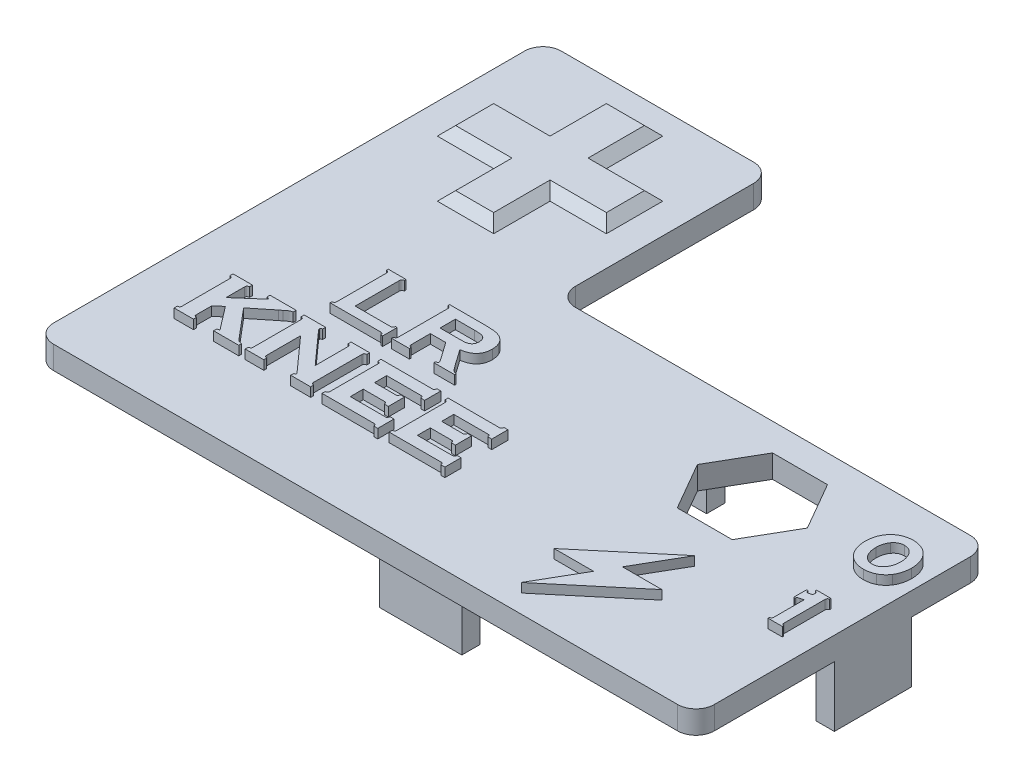
from build123d import *

# Parameters (mm, degrees)
BOSS_EXTRUDE1_DEPTH = 2.5
FILLET1_R           = 2
SKETCH2_W           = 2
SKETCH2_H           = 8.4
SKETCH2_W_2         = 9
SKETCH2_H_2         = 2
BOSS_EXTRUDE2_DEPTH = 6.6
BOSS_EXTRUDE3_DEPTH = 1
CUT_EXTRUDE1_DEPTH  = 2.5
CHAMFER1_SIZE       = 1


with BuildPart() as part:
    # Sketch1 → Boss-Extrude1 (new body)
    with BuildSketch(Plane(origin=(0, 0, 0), x_dir=(1, 0, 0), z_dir=(0, 1, 0))):
        Polygon((-36.05, 15.975), (-36.05, 39.425), (-11.05, 39.425), (-11.05, 15.975), (36.05, 15.975), (36.05, -15.975), (-36.05, -15.975), align=None)
    extrude(amount=BOSS_EXTRUDE1_DEPTH)

    # Fillet1
    fillet1_edges = [part.edges().sort_by_distance(p)[0] for p in [
        (36.05, 1.25, 15.975),
        (-36.05, 1.25, 15.975),
        (-36.05, 1.25, -39.425),
        (-11.05, 1.25, -39.425),
        (-11.05, 1.25, -15.975),
        (36.05, 1.25, -15.975),
    ]]
    fillet(fillet1_edges, radius=FILLET1_R)

    # Sketch2 → Boss-Extrude2 (add)
    with BuildSketch(Plane.XZ):
        with Locations((35.05, -3.325)):
            Rectangle(SKETCH2_W, SKETCH2_H)
        with Locations((4, -13.725)):
            Rectangle(SKETCH2_W_2, SKETCH2_H_2)
        with Locations((4, 12.975)):
            Rectangle(SKETCH2_W_2, SKETCH2_H_2)
    extrude(amount=BOSS_EXTRUDE2_DEPTH)

    # Sketch3 → Boss-Extrude3 (add)
    # profile 1 of 10: a face of its own
    with BuildSketch(Plane(origin=(0, 2.5, 0), x_dir=(1, 0, 0), z_dir=(0, 1, 0))):
        Polygon((21.914101615, -1.975), (19.027350269, -6.975), (23.328173533, -6.975), (14.985898385, -13.975), (17.872649731, -8.975), (13.571826467, -8.975), align=None)
    # profile 2 of 10: a face of its own
    with BuildSketch(Plane(origin=(0, 2.5, 0), x_dir=(1, 0, 0), z_dir=(0, 1, 0))):
        Polygon((-26.625, 36.925), (-20.475, 36.925), (-20.475, 30.775), (-14.325, 30.775), (-14.325, 24.625), (-20.475, 24.625), (-20.475, 18.475), (-26.625, 18.475), (-26.625, 24.625), (-32.775, 24.625), (-32.775, 30.775), (-26.625, 30.775), align=None)
    # profile 3 of 10: a face of its own
    with BuildSketch(Plane(origin=(0, 2.5, 0), x_dir=(1, 0, 0), z_dir=(0, 1, 0))):
        with BuildLine():
            Line((-27.247591146, -4.027376302), (-28.044097222, -4.731553819))
            Line((-28.044097222, -4.731553819), (-28.044097222, -6.378309462))
            add(Edge.make_bspline(
                [(-28.044097222, -6.378309462), (-28.043614142, -6.399472319), (-28.042739336, -6.437795987), (-28.035657403, -6.489945623), (-28.02621669, -6.531568086), (-28.008147517, -6.565285209), (-27.974962409, -6.59109629), (-27.926455941, -6.614285804), (-27.859074511, -6.638583322), (-27.80806186, -6.654600019), (-27.779513889, -6.663563368)],
                knots=[0, 0, 0, 0, 1.148820936, 2.080391588, 2.85507263, 3.458551883, 4.113480583, 5.09547749, 6.374555674, 8, 8, 8, 8], degree=3))
            Line((-27.779513889, -6.663563368), (-27.779513889, -6.975))
            Line((-27.779513889, -6.975), (-29.896180556, -6.975))
            Line((-29.896180556, -6.975), (-29.896180556, -6.645648872))
            add(Edge.make_bspline(
                [(-29.896180556, -6.645648872), (-29.868125509, -6.636151539), (-29.817620866, -6.619054457), (-29.750632152, -6.594290002), (-29.702846169, -6.568424236), (-29.659464272, -6.534244531), (-29.634968184, -6.466247275), (-29.632831214, -6.41050045), (-29.631597222, -6.378309462)],
                knots=[0, 0, 0, 0, 1.270903566, 2.287878308, 3.055159144, 3.600028367, 4.614137041, 6, 6, 6, 6], degree=3))
            Line((-29.631597222, -6.378309462), (-29.631597222, -1.127983941))
            add(Edge.make_bspline(
                [(-29.631597222, -1.127983941), (-29.632760861, -1.09708089), (-29.634782292, -1.043397214), (-29.66024702, -0.97844533), (-29.702812577, -0.944749705), (-29.750645988, -0.918897567), (-29.817615885, -0.894127705), (-29.868123731, -0.877031544), (-29.896180556, -0.867534722)],
                knots=[0, 0, 0, 0, 1.348336138, 2.342281394, 2.895882114, 3.675458579, 4.708730281, 6, 6, 6, 6], degree=3))
            Line((-29.896180556, -0.867534722), (-29.896180556, -0.536805556))
            Line((-29.896180556, -0.536805556), (-27.779513889, -0.536805556))
            Line((-27.779513889, -0.536805556), (-27.779513889, -0.850998264))
            add(Edge.make_bspline(
                [(-27.779513889, -0.850998264), (-27.808604169, -0.859263131), (-27.86035741, -0.873966793), (-27.92739581, -0.899411349), (-27.976517897, -0.92063671), (-28.009276456, -0.946020118), (-28.025676001, -0.978778043), (-28.03589813, -1.017604085), (-28.042562776, -1.066223073), (-28.043557084, -1.101778809), (-28.044097222, -1.12109375)],
                knots=[0, 0, 0, 0, 1.689553727, 3.005810864, 4.004869542, 4.678835048, 5.264901578, 6.012599175, 6.920384306, 8, 8, 8, 8], degree=3))
            Line((-28.044097222, -1.12109375), (-28.044097222, -3.15921224))
            Line((-28.044097222, -3.15921224), (-25.746907552, -1.147276476))
            add(Edge.make_bspline(
                [(-25.746907552, -1.147276476), (-25.72505987, -1.129143656), (-25.686439291, -1.097089912), (-25.639092829, -1.052208786), (-25.608302482, -1.016007235), (-25.600873058, -0.992230514), (-25.598079427, -0.983289931)],
                knots=[0, 0, 0, 0, 1.515017203, 2.678125759, 3.502945504, 4, 4, 4, 4], degree=3))
            add(Edge.make_bspline(
                [(-25.598079427, -0.983289931), (-25.6027921, -0.972871707), (-25.615528981, -0.944714503), (-25.67549815, -0.922434641), (-25.757063022, -0.894133596), (-25.825856322, -0.881620882), (-25.865418837, -0.874424913)],
                knots=[0, 0, 0, 0, 0.446973481, 1.208029717, 2.394358675, 4, 4, 4, 4], degree=3))
            Line((-25.865418837, -0.874424913), (-25.865418837, -0.536805556))
            Line((-25.865418837, -0.536805556), (-23.017013889, -0.536805556))
            Line((-23.017013889, -0.536805556), (-23.017013889, -0.859266493))
            add(Edge.make_bspline(
                [(-23.017013889, -0.859266493), (-23.05420703, -0.867039679), (-23.119525289, -0.880690878), (-23.205630499, -0.899085661), (-23.264473909, -0.916834955), (-23.302334751, -0.929405829), (-23.324552038, -0.94737057), (-23.350549511, -0.965117026), (-23.385491064, -0.992852381), (-23.43105823, -1.028538429), (-23.486145288, -1.072692799), (-23.551023452, -1.125487776), (-23.62675191, -1.185630628), (-23.680346475, -1.228994311), (-23.708789062, -1.252007378)],
                knots=[0, 0, 0, 0, 1.684495241, 2.95829537, 3.892088238, 4.42126145, 4.698089674, 5.149995523, 5.817617521, 6.672678047, 7.715250913, 8.945376179, 10.378913871, 12, 12, 12, 12], degree=3))
            Line((-23.708789062, -1.252007378), (-23.994042969, -1.46422526))
            Line((-23.994042969, -1.46422526), (-26.112087674, -3.172992622))
            Line((-26.112087674, -3.172992622), (-23.739105903, -5.986946615))
            add(Edge.make_bspline(
                [(-23.739105903, -5.986946615), (-23.710640531, -6.021868095), (-23.656609312, -6.088153903), (-23.579507577, -6.182305046), (-23.509269617, -6.265043392), (-23.445716352, -6.337048307), (-23.388972388, -6.398402958), (-23.341940336, -6.451477179), (-23.299707346, -6.491542629), (-23.252851428, -6.53433952), (-23.185902519, -6.575932546), (-23.089850939, -6.615313875), (-22.972936565, -6.649291216), (-22.886745928, -6.664872196), (-22.840625, -6.673209635)],
                knots=[0, 0, 0, 0, 1.3856826, 2.630217524, 3.742735644, 4.723579208, 5.583639575, 6.31351798, 6.903006854, 7.373487758, 8.263094004, 9.3075047, 10.559235838, 12, 12, 12, 12], degree=3))
            Line((-22.840625, -6.673209635), (-22.840625, -6.975))
            Line((-22.840625, -6.975), (-25.580164931, -6.975))
            Line((-25.580164931, -6.975), (-25.580164931, -6.638758681))
            add(Edge.make_bspline(
                [(-25.580164931, -6.638758681), (-25.543953919, -6.631181887), (-25.481134588, -6.618037568), (-25.405113126, -6.593213057), (-25.350570335, -6.572288109), (-25.337935176, -6.547034268), (-25.333496094, -6.538161892)],
                knots=[0, 0, 0, 0, 1.609728793, 2.792578347, 3.575799217, 4, 4, 4, 4], degree=3))
            add(Edge.make_bspline(
                [(-25.333496094, -6.538161892), (-25.337343345, -6.528360921), (-25.349550932, -6.49726178), (-25.392594167, -6.442765021), (-25.456187732, -6.358573837), (-25.50868088, -6.294077528), (-25.538823785, -6.257042101)],
                knots=[0, 0, 0, 0, 0.360711672, 1.144562472, 2.360334903, 4, 4, 4, 4], degree=3))
            Line((-25.538823785, -6.257042101), (-27.247591146, -4.027376302))
        make_face()
    # profile 4 of 10: a face of its own
    with BuildSketch(Plane(origin=(0, 2.5, 0), x_dir=(1, 0, 0), z_dir=(0, 1, 0))):
        with BuildLine():
            Line((-20.371180556, -2.697569444), (-20.371180556, -6.378309462))
            add(Edge.make_bspline(
                [(-20.371180556, -6.378309462), (-20.370486031, -6.399897216), (-20.369242065, -6.438563153), (-20.364587286, -6.491497032), (-20.354507946, -6.532130236), (-20.338116323, -6.565843949), (-20.304345381, -6.589008268), (-20.25705099, -6.613648804), (-20.188483243, -6.638793202), (-20.136050097, -6.655536385), (-20.106597222, -6.664941406)],
                knots=[0, 0, 0, 0, 1.168297272, 2.092543193, 2.863626271, 3.430493718, 4.06657787, 5.021996077, 6.327188346, 8, 8, 8, 8], degree=3))
            Line((-20.106597222, -6.664941406), (-20.106597222, -6.975))
            Line((-20.106597222, -6.975), (-22.135069444, -6.975))
            Line((-22.135069444, -6.975), (-22.135069444, -6.645648872))
            add(Edge.make_bspline(
                [(-22.135069444, -6.645648872), (-22.107014398, -6.636151539), (-22.056509755, -6.619054457), (-21.989521041, -6.594290002), (-21.941735058, -6.568424236), (-21.89835316, -6.534244531), (-21.873857072, -6.466247275), (-21.871720103, -6.41050045), (-21.870486111, -6.378309462)],
                knots=[0, 0, 0, 0, 1.270903566, 2.287878308, 3.055159144, 3.600028367, 4.614137041, 6, 6, 6, 6], degree=3))
            Line((-21.870486111, -6.378309462), (-21.870486111, -1.127983941))
            add(Edge.make_bspline(
                [(-21.870486111, -1.127983941), (-21.87164975, -1.09708089), (-21.873671181, -1.043397214), (-21.899135909, -0.97844533), (-21.941701466, -0.944749705), (-21.989534877, -0.918897567), (-22.056504774, -0.894127705), (-22.10701262, -0.877031544), (-22.135069444, -0.867534722)],
                knots=[0, 0, 0, 0, 1.348336138, 2.342281394, 2.895882114, 3.675458579, 4.708730281, 6, 6, 6, 6], degree=3))
            Line((-22.135069444, -0.867534722), (-22.135069444, -0.536805556))
            Line((-22.135069444, -0.536805556), (-19.800672743, -0.536805556))
            Line((-19.800672743, -0.536805556), (-19.800672743, -0.852376302))
            add(Edge.make_bspline(
                [(-19.800672743, -0.852376302), (-19.829012696, -0.861127625), (-19.879583335, -0.876743742), (-19.944116626, -0.90956379), (-19.985225933, -0.956210264), (-19.99090704, -0.992352602), (-19.99359809, -1.009472656)],
                knots=[0, 0, 0, 0, 1.333897094, 2.380244923, 3.232747595, 4, 4, 4, 4], degree=3))
            add(Edge.make_bspline(
                [(-19.99359809, -1.009472656), (-19.990089309, -1.042843704), (-19.982967936, -1.11057311), (-19.939736703, -1.163265439), (-19.91780599, -1.18999566)],
                knots=[0, 0, 0, 0, 0.985422698, 2, 2, 2, 2], degree=3))
            Line((-19.91780599, -1.18999566), (-16.755208333, -4.719151476))
            Line((-16.755208333, -4.719151476), (-16.755208333, -1.127983941))
            add(Edge.make_bspline(
                [(-16.755208333, -1.127983941), (-16.756371972, -1.09708089), (-16.758393403, -1.043397214), (-16.783858131, -0.97844533), (-16.826423688, -0.944749705), (-16.874257099, -0.918897567), (-16.941226996, -0.894127705), (-16.991734842, -0.877031544), (-17.019791667, -0.867534722)],
                knots=[0, 0, 0, 0, 1.348336138, 2.342281394, 2.895882114, 3.675458579, 4.708730281, 6, 6, 6, 6], degree=3))
            Line((-17.019791667, -0.867534722), (-17.019791667, -0.536805556))
            Line((-17.019791667, -0.536805556), (-14.991319444, -0.536805556))
            Line((-14.991319444, -0.536805556), (-14.991319444, -0.848242187))
            add(Edge.make_bspline(
                [(-14.991319444, -0.848242187), (-15.020339683, -0.857626663), (-15.072326352, -0.874437952), (-15.1404688, -0.900165223), (-15.189402175, -0.923510568), (-15.222504384, -0.948727557), (-15.238775464, -0.981558828), (-15.24960282, -1.020687503), (-15.253796275, -1.070960242), (-15.255156418, -1.107779735), (-15.255902778, -1.127983941)],
                knots=[0, 0, 0, 0, 1.677063113, 3.004280154, 3.998210204, 4.661097541, 5.237530725, 5.972938197, 6.887676847, 8, 8, 8, 8], degree=3))
            Line((-15.255902778, -1.127983941), (-15.255902778, -6.378309462))
            add(Edge.make_bspline(
                [(-15.255902778, -6.378309462), (-15.255208253, -6.399897216), (-15.253964287, -6.438563153), (-15.249309509, -6.491497032), (-15.239230169, -6.532130236), (-15.222838545, -6.565843949), (-15.189067603, -6.589008268), (-15.141773212, -6.613648804), (-15.073205465, -6.638793202), (-15.02077232, -6.655536385), (-14.991319444, -6.664941406)],
                knots=[0, 0, 0, 0, 1.168297272, 2.092543193, 2.863626271, 3.430493718, 4.06657787, 5.021996077, 6.327188346, 8, 8, 8, 8], degree=3))
            Line((-14.991319444, -6.664941406), (-14.991319444, -6.975))
            Line((-14.991319444, -6.975), (-17.172753906, -6.975))
            Line((-17.172753906, -6.975), (-17.172753906, -6.640136719))
            add(Edge.make_bspline(
                [(-17.172753906, -6.640136719), (-17.144688608, -6.633446707), (-17.095490609, -6.621719228), (-17.036525288, -6.592542598), (-16.992329434, -6.559640341), (-16.987541059, -6.528873277), (-16.985340712, -6.514735243)],
                knots=[0, 0, 0, 0, 1.427158009, 2.501784109, 3.311542117, 4, 4, 4, 4], degree=3))
            add(Edge.make_bspline(
                [(-16.985340712, -6.514735243), (-16.98895039, -6.502543418), (-16.998709509, -6.469581625), (-17.039839127, -6.416367421), (-17.101478263, -6.344175674), (-17.152219059, -6.290351523), (-17.181022135, -6.259798177)],
                knots=[0, 0, 0, 0, 0.467922828, 1.265075161, 2.447516532, 4, 4, 4, 4], degree=3))
            Line((-17.181022135, -6.259798177), (-20.371180556, -2.697569444))
        make_face()
    # profile 5 of 10: a face of its own
    with BuildSketch(Plane(origin=(0, 2.5, 0), x_dir=(1, 0, 0), z_dir=(0, 1, 0))):
        with BuildLine():
            Line((-11.904513889, -4.329166667), (-11.904513889, -5.740277778))
            Line((-11.904513889, -5.740277778), (-8.08734809, -5.740277778))
            add(Edge.make_bspline(
                [(-8.08734809, -5.740277778), (-8.056397323, -5.739196439), (-8.002019061, -5.737296604), (-7.936927508, -5.710572029), (-7.90265729, -5.667750897), (-7.877156292, -5.619542044), (-7.850290079, -5.553870821), (-7.834297431, -5.50339503), (-7.825520833, -5.475694444)],
                knots=[0, 0, 0, 0, 1.34636125, 2.365459444, 2.918249314, 3.696683944, 4.73596426, 6, 6, 6, 6], degree=3))
            Line((-7.825520833, -5.475694444), (-7.406597222, -5.475694444))
            Line((-7.406597222, -5.475694444), (-7.406597222, -7.239583333))
            Line((-7.406597222, -7.239583333), (-7.825520833, -7.239583333))
            add(Edge.make_bspline(
                [(-7.825520833, -7.239583333), (-7.835001074, -7.211528728), (-7.851930948, -7.161428635), (-7.876789708, -7.094617869), (-7.904172014, -7.047847345), (-7.937939248, -7.005029981), (-8.001016174, -6.978204932), (-8.053625296, -6.976153677), (-8.083213976, -6.975)],
                knots=[0, 0, 0, 0, 1.304247938, 2.329134225, 3.126603422, 3.68576824, 4.698418437, 6, 6, 6, 6], degree=3))
            Line((-8.083213976, -6.975), (-13.756597222, -6.975))
            Line((-13.756597222, -6.975), (-13.756597222, -6.645648872))
            add(Edge.make_bspline(
                [(-13.756597222, -6.645648872), (-13.728542176, -6.636151539), (-13.678037533, -6.619054457), (-13.611048819, -6.594290002), (-13.563262836, -6.568424236), (-13.519880938, -6.534244531), (-13.49538485, -6.466247275), (-13.493247881, -6.41050045), (-13.492013889, -6.378309462)],
                knots=[0, 0, 0, 0, 1.270903566, 2.287878308, 3.055159144, 3.600028367, 4.614137041, 6, 6, 6, 6], degree=3))
            Line((-13.492013889, -6.378309462), (-13.492013889, -1.133496094))
            add(Edge.make_bspline(
                [(-13.492013889, -1.133496094), (-13.493129536, -1.101255409), (-13.495047109, -1.045840197), (-13.520270062, -0.978690716), (-13.563247044, -0.944754866), (-13.611055323, -0.918895441), (-13.678035191, -0.894128471), (-13.72854134, -0.877031817), (-13.756597222, -0.867534722)],
                knots=[0, 0, 0, 0, 1.390022291, 2.38916702, 2.935671537, 3.705255179, 4.725282125, 6, 6, 6, 6], degree=3))
            Line((-13.756597222, -0.867534722), (-13.756597222, -0.536805556))
            Line((-13.756597222, -0.536805556), (-8.172786458, -0.536805556))
            add(Edge.make_bspline(
                [(-8.172786458, -0.536805556), (-8.142733987, -0.53571096), (-8.089655793, -0.533777704), (-8.026124978, -0.50678001), (-7.992386225, -0.46395028), (-7.964640924, -0.416868232), (-7.940723815, -0.349691075), (-7.923319713, -0.299770719), (-7.913715278, -0.272222222)],
                knots=[0, 0, 0, 0, 1.317339458, 2.326663858, 2.883992238, 3.678842347, 4.719071565, 6, 6, 6, 6], degree=3))
            Line((-7.913715278, -0.272222222), (-7.494791667, -0.272222222))
            Line((-7.494791667, -0.272222222), (-7.494791667, -2.036111111))
            Line((-7.494791667, -2.036111111), (-7.913715278, -2.036111111))
            add(Edge.make_bspline(
                [(-7.913715278, -2.036111111), (-7.92239102, -2.00835834), (-7.938073465, -1.958191877), (-7.965816655, -1.893457716), (-7.990605526, -1.844806679), (-8.027257116, -1.802911028), (-8.091564121, -1.774295539), (-8.146309251, -1.772520378), (-8.176920573, -1.771527778)],
                knots=[0, 0, 0, 0, 1.263696698, 2.284283375, 3.062509213, 3.628357544, 4.673870881, 6, 6, 6, 6], degree=3))
            Line((-8.176920573, -1.771527778), (-11.904513889, -1.771527778))
            Line((-11.904513889, -1.771527778), (-11.904513889, -3.094444444))
            Line((-11.904513889, -3.094444444), (-9.583897569, -3.094444444))
            add(Edge.make_bspline(
                [(-9.583897569, -3.094444444), (-9.552984438, -3.093286079), (-9.499283249, -3.091273808), (-9.43442255, -3.065761382), (-9.400262411, -3.022985336), (-9.37562489, -2.974541889), (-9.34936366, -2.908395749), (-9.333622038, -2.858012697), (-9.324826389, -2.829861111)],
                knots=[0, 0, 0, 0, 1.350007337, 2.345184541, 2.899471423, 3.697568048, 4.713513627, 6, 6, 6, 6], degree=3))
            Line((-9.324826389, -2.829861111), (-8.905902778, -2.829861111))
            Line((-8.905902778, -2.829861111), (-8.905902778, -4.59375))
            Line((-8.905902778, -4.59375), (-9.324826389, -4.59375))
            add(Edge.make_bspline(
                [(-9.324826389, -4.59375), (-9.334395473, -4.566642156), (-9.351710657, -4.517590719), (-9.376075187, -4.451549956), (-9.403451363, -4.404719593), (-9.437477396, -4.361965651), (-9.500379724, -4.333328245), (-9.553764905, -4.330668136), (-9.583897569, -4.329166667)],
                knots=[0, 0, 0, 0, 1.26750182, 2.293534889, 3.091896403, 3.651686891, 4.674521096, 6, 6, 6, 6], degree=3))
            Line((-9.583897569, -4.329166667), (-11.904513889, -4.329166667))
        make_face()
    # profile 6 of 10: a face of its own
    with BuildSketch(Plane(origin=(0, 2.5, 0), x_dir=(1, 0, 0), z_dir=(0, 1, 0))):
        with BuildLine():
            Line((-4.584375, -4.329166667), (-4.584375, -5.740277778))
            Line((-4.584375, -5.740277778), (-0.767209201, -5.740277778))
            add(Edge.make_bspline(
                [(-0.767209201, -5.740277778), (-0.736258434, -5.739196439), (-0.681880172, -5.737296604), (-0.616788619, -5.710572029), (-0.582518401, -5.667750897), (-0.557017403, -5.619542044), (-0.53015119, -5.553870821), (-0.514158542, -5.50339503), (-0.505381944, -5.475694444)],
                knots=[0, 0, 0, 0, 1.34636125, 2.365459444, 2.918249314, 3.696683944, 4.73596426, 6, 6, 6, 6], degree=3))
            Line((-0.505381944, -5.475694444), (-0.086458333, -5.475694444))
            Line((-0.086458333, -5.475694444), (-0.086458333, -7.239583333))
            Line((-0.086458333, -7.239583333), (-0.505381944, -7.239583333))
            add(Edge.make_bspline(
                [(-0.505381944, -7.239583333), (-0.514862185, -7.211528728), (-0.531792059, -7.161428635), (-0.556650819, -7.094617869), (-0.584033125, -7.047847345), (-0.617800359, -7.005029981), (-0.680877285, -6.978204932), (-0.733486407, -6.976153677), (-0.763075087, -6.975)],
                knots=[0, 0, 0, 0, 1.304247938, 2.329134225, 3.126603422, 3.68576824, 4.698418437, 6, 6, 6, 6], degree=3))
            Line((-0.763075087, -6.975), (-6.436458333, -6.975))
            Line((-6.436458333, -6.975), (-6.436458333, -6.645648872))
            add(Edge.make_bspline(
                [(-6.436458333, -6.645648872), (-6.408403287, -6.636151539), (-6.357898644, -6.619054457), (-6.29090993, -6.594290002), (-6.243123947, -6.568424236), (-6.199742049, -6.534244531), (-6.175245961, -6.466247275), (-6.173108992, -6.41050045), (-6.171875, -6.378309462)],
                knots=[0, 0, 0, 0, 1.270903566, 2.287878308, 3.055159144, 3.600028367, 4.614137041, 6, 6, 6, 6], degree=3))
            Line((-6.171875, -6.378309462), (-6.171875, -1.133496094))
            add(Edge.make_bspline(
                [(-6.171875, -1.133496094), (-6.172990647, -1.101255409), (-6.17490822, -1.045840197), (-6.200131173, -0.978690716), (-6.243108155, -0.944754866), (-6.290916434, -0.918895441), (-6.357896302, -0.894128471), (-6.408402451, -0.877031817), (-6.436458333, -0.867534722)],
                knots=[0, 0, 0, 0, 1.390022291, 2.38916702, 2.935671537, 3.705255179, 4.725282125, 6, 6, 6, 6], degree=3))
            Line((-6.436458333, -0.867534722), (-6.436458333, -0.536805556))
            Line((-6.436458333, -0.536805556), (-0.852647569, -0.536805556))
            add(Edge.make_bspline(
                [(-0.852647569, -0.536805556), (-0.822595098, -0.53571096), (-0.769516904, -0.533777704), (-0.705986089, -0.50678001), (-0.672247336, -0.46395028), (-0.644502035, -0.416868232), (-0.620584926, -0.349691075), (-0.603180824, -0.299770719), (-0.593576389, -0.272222222)],
                knots=[0, 0, 0, 0, 1.317339458, 2.326663858, 2.883992238, 3.678842347, 4.719071565, 6, 6, 6, 6], degree=3))
            Line((-0.593576389, -0.272222222), (-0.174652778, -0.272222222))
            Line((-0.174652778, -0.272222222), (-0.174652778, -2.036111111))
            Line((-0.174652778, -2.036111111), (-0.593576389, -2.036111111))
            add(Edge.make_bspline(
                [(-0.593576389, -2.036111111), (-0.602252131, -2.00835834), (-0.617934576, -1.958191877), (-0.645677766, -1.893457716), (-0.670466637, -1.844806679), (-0.707118227, -1.802911028), (-0.771425232, -1.774295539), (-0.826170362, -1.772520378), (-0.856781684, -1.771527778)],
                knots=[0, 0, 0, 0, 1.263696698, 2.284283375, 3.062509213, 3.628357544, 4.673870881, 6, 6, 6, 6], degree=3))
            Line((-0.856781684, -1.771527778), (-4.584375, -1.771527778))
            Line((-4.584375, -1.771527778), (-4.584375, -3.094444444))
            Line((-4.584375, -3.094444444), (-2.263758681, -3.094444444))
            add(Edge.make_bspline(
                [(-2.263758681, -3.094444444), (-2.232845549, -3.093286079), (-2.179144361, -3.091273808), (-2.114283661, -3.065761382), (-2.080123522, -3.022985336), (-2.055486001, -2.974541889), (-2.029224771, -2.908395749), (-2.013483149, -2.858012697), (-2.0046875, -2.829861111)],
                knots=[0, 0, 0, 0, 1.350007337, 2.345184541, 2.899471423, 3.697568048, 4.713513627, 6, 6, 6, 6], degree=3))
            Line((-2.0046875, -2.829861111), (-1.585763889, -2.829861111))
            Line((-1.585763889, -2.829861111), (-1.585763889, -4.59375))
            Line((-1.585763889, -4.59375), (-2.0046875, -4.59375))
            add(Edge.make_bspline(
                [(-2.0046875, -4.59375), (-2.014256584, -4.566642156), (-2.031571768, -4.517590719), (-2.055936298, -4.451549956), (-2.083312474, -4.404719593), (-2.117338507, -4.361965651), (-2.180240835, -4.333328245), (-2.233626016, -4.330668136), (-2.263758681, -4.329166667)],
                knots=[0, 0, 0, 0, 1.26750182, 2.293534889, 3.091896403, 3.651686891, 4.674521096, 6, 6, 6, 6], degree=3))
            Line((-2.263758681, -4.329166667), (-4.584375, -4.329166667))
        make_face()
    # profile 7 of 10: a face of its own
    with BuildSketch(Plane(origin=(0, 2.5, 0), x_dir=(1, 0, 0), z_dir=(0, 1, 0))):
        with BuildLine():
            Line((-20.194791667, 3.083333333), (-16.381759983, 3.083333333))
            add(Edge.make_bspline(
                [(-16.381759983, 3.083333333), (-16.359669473, 3.08415726), (-16.317940569, 3.085713654), (-16.259695093, 3.096279186), (-16.209945218, 3.114668035), (-16.166613255, 3.139486458), (-16.130762423, 3.176744953), (-16.099829999, 3.223685494), (-16.071795056, 3.281692258), (-16.057399092, 3.324748542), (-16.049652778, 3.347916667)],
                knots=[0, 0, 0, 0, 1.13718709, 2.148142964, 3.030969728, 3.85821599, 4.694202194, 5.66481062, 6.743459618, 8, 8, 8, 8], degree=3))
            Line((-16.049652778, 3.347916667), (-15.873263889, 3.347916667))
            Line((-15.873263889, 3.347916667), (-15.873263889, 1.760416667))
            Line((-15.873263889, 1.760416667), (-16.049652778, 1.760416667))
            add(Edge.make_bspline(
                [(-16.049652778, 1.760416667), (-16.05751257, 1.783522919), (-16.072252661, 1.826855906), (-16.098990934, 1.885620961), (-16.131257353, 1.931681921), (-16.166513714, 1.969016056), (-16.210280722, 1.993225085), (-16.259600252, 2.014506541), (-16.319116666, 2.021822153), (-16.361106198, 2.0239064), (-16.383138021, 2.025)],
                knots=[0, 0, 0, 0, 1.251925329, 2.347834872, 3.295457317, 4.12837309, 4.952581021, 5.840642677, 6.866989599, 8, 8, 8, 8], degree=3))
            Line((-16.383138021, 2.025), (-21.870486111, 2.025))
            Line((-21.870486111, 2.025), (-21.870486111, 2.201388889))
            add(Edge.make_bspline(
                [(-21.870486111, 2.201388889), (-21.84737908, 2.209248385), (-21.804044632, 2.223987922), (-21.745289064, 2.250729794), (-21.699198827, 2.282985108), (-21.661957986, 2.318276858), (-21.636981363, 2.362666226), (-21.617173449, 2.412988597), (-21.608749169, 2.473072668), (-21.606895471, 2.51511544), (-21.605902778, 2.537630208)],
                knots=[0, 0, 0, 0, 1.245049627, 2.334940322, 3.277358327, 4.105699642, 4.925380938, 5.852235277, 6.849827876, 8, 8, 8, 8], degree=3))
            Line((-21.605902778, 2.537630208), (-21.605902778, 7.862369792))
            add(Edge.make_bspline(
                [(-21.605902778, 7.862369792), (-21.606915907, 7.884878495), (-21.608807765, 7.926909942), (-21.616922496, 7.986640616), (-21.637244869, 8.03635842), (-21.66234903, 8.080392165), (-21.698667664, 8.117087354), (-21.745374463, 8.14918498), (-21.804018234, 8.176038422), (-21.847369899, 8.190760777), (-21.870486111, 8.198611111)],
                knots=[0, 0, 0, 0, 1.150912396, 2.149147064, 3.054708998, 3.874917856, 4.720532304, 5.663556867, 6.754149036, 8, 8, 8, 8], degree=3))
            Line((-21.870486111, 8.198611111), (-21.870486111, 8.375))
            Line((-21.870486111, 8.375), (-19.930208333, 8.375))
            Line((-19.930208333, 8.375), (-19.930208333, 8.198611111))
            add(Edge.make_bspline(
                [(-19.930208333, 8.198611111), (-19.95332054, 8.191247244), (-19.996209045, 8.177582375), (-20.05517834, 8.151564947), (-20.101451545, 8.118754642), (-20.138718662, 8.081592477), (-20.163451889, 8.03687586), (-20.181829327, 7.98577935), (-20.19240531, 7.926178987), (-20.193966206, 7.883540547), (-20.194791667, 7.860991753)],
                knots=[0, 0, 0, 0, 1.233044476, 2.288117098, 3.259808654, 4.10196579, 4.938928384, 5.832590396, 6.853793133, 8, 8, 8, 8], degree=3))
            Line((-20.194791667, 7.860991753), (-20.194791667, 3.083333333))
        make_face()
    # profile 8 of 10: a face of its own
    with BuildSketch(Plane(origin=(0, 2.5, 0), x_dir=(1, 0, 0), z_dir=(0, 1, 0))):
        with BuildLine():
            Line((-13.492013889, 4.582638889), (-13.492013889, 2.527983941))
            add(Edge.make_bspline(
                [(-13.492013889, 2.527983941), (-13.491216918, 2.506342162), (-13.489713044, 2.46550442), (-13.47876255, 2.408306229), (-13.460907961, 2.358547365), (-13.434365104, 2.315422257), (-13.396056206, 2.280677062), (-13.350508551, 2.248088055), (-13.292402129, 2.222700887), (-13.250058737, 2.208811393), (-13.227430556, 2.201388889)],
                knots=[0, 0, 0, 0, 1.124460146, 2.121840966, 3.013286232, 3.861139776, 4.722335659, 5.682736552, 6.761661326, 8, 8, 8, 8], degree=3))
            Line((-13.227430556, 2.201388889), (-13.227430556, 2.025))
            Line((-13.227430556, 2.025), (-15.167708333, 2.025))
            Line((-15.167708333, 2.025), (-15.167708333, 2.201388889))
            add(Edge.make_bspline(
                [(-15.167708333, 2.201388889), (-15.144601639, 2.209248522), (-15.101267823, 2.223988314), (-15.042508153, 2.250728526), (-14.996430573, 2.282988964), (-14.959149401, 2.318264384), (-14.934534954, 2.362337372), (-14.914335353, 2.411541713), (-14.905979199, 2.470319155), (-14.904121286, 2.511443566), (-14.903125, 2.533496094)],
                knots=[0, 0, 0, 0, 1.255780561, 2.355064893, 3.305605487, 4.141086176, 4.967832208, 5.880611589, 6.863500559, 8, 8, 8, 8], degree=3))
            Line((-14.903125, 2.533496094), (-14.903125, 7.862369792))
            add(Edge.make_bspline(
                [(-14.903125, 7.862369792), (-14.904138129, 7.884878495), (-14.906029987, 7.926909942), (-14.914144718, 7.986640616), (-14.934467091, 8.03635842), (-14.959571252, 8.080392165), (-14.995889886, 8.117087354), (-15.042596685, 8.14918498), (-15.101240456, 8.176038422), (-15.144592122, 8.190760777), (-15.167708333, 8.198611111)],
                knots=[0, 0, 0, 0, 1.150912396, 2.149147064, 3.054708998, 3.874917856, 4.720532304, 5.663556867, 6.754149036, 8, 8, 8, 8], degree=3))
            Line((-15.167708333, 8.198611111), (-15.167708333, 8.375))
            Line((-15.167708333, 8.375), (-11.23203125, 8.375))
            add(Edge.make_bspline(
                [(-11.23203125, 8.375), (-11.118095899, 8.37394185), (-10.902975765, 8.371943968), (-10.598579471, 8.357312062), (-10.331644526, 8.332343595), (-10.097596914, 8.295250246), (-9.888734521, 8.244849599), (-9.69674322, 8.180844138), (-9.518372225, 8.099345565), (-9.409176957, 8.032080657), (-9.355143229, 7.998795573)],
                knots=[0, 0, 0, 0, 1.407806318, 2.658064248, 3.764457201, 4.719038315, 5.583565669, 6.416396437, 7.216376255, 8, 8, 8, 8], degree=3))
            add(Edge.make_bspline(
                [(-9.355143229, 7.998795573), (-9.29674757, 7.956392494), (-9.180940499, 7.87230103), (-9.032606466, 7.71612757), (-8.906249233, 7.540142276), (-8.843811781, 7.409168697), (-8.812196181, 7.342849392)],
                knots=[0, 0, 0, 0, 1.001529461, 1.98617835, 2.980288594, 4, 4, 4, 4], degree=3))
            add(Edge.make_bspline(
                [(-8.812196181, 7.342849392), (-8.785914331, 7.275815443), (-8.733134514, 7.141196319), (-8.680614378, 6.929738528), (-8.647694021, 6.711370865), (-8.643464105, 6.56345986), (-8.641319444, 6.488465712)],
                knots=[0, 0, 0, 0, 0.984363557, 1.976821606, 2.974203853, 4, 4, 4, 4], degree=3))
            add(Edge.make_bspline(
                [(-8.641319444, 6.488465712), (-8.64253718, 6.425468581), (-8.644917323, 6.30233657), (-8.666560604, 6.122739113), (-8.698593487, 5.952792968), (-8.745798949, 5.793110306), (-8.806476043, 5.643404224), (-8.881036513, 5.504028837), (-8.968516489, 5.374484989), (-9.06980986, 5.255361151), (-9.184938402, 5.146048408), (-9.313310168, 5.046826682), (-9.45552805, 4.957903244), (-9.611089861, 4.879762369), (-9.780130717, 4.812578125), (-9.961946861, 4.754422431), (-10.157230339, 4.706366704), (-10.292964279, 4.682869129), (-10.362489149, 4.670833333)],
                knots=[0, 0, 0, 0, 1.087205603, 2.125014432, 3.118864887, 4.069900136, 4.994750613, 5.903029732, 6.793864856, 7.688469125, 8.597198221, 9.529937486, 10.484899445, 11.48860474, 12.531250455, 13.622238558, 14.782076498, 16, 16, 16, 16], degree=3))
            Line((-10.362489149, 4.670833333), (-9.13327908, 2.922102865))
            add(Edge.make_bspline(
                [(-9.13327908, 2.922102865), (-9.107268167, 2.886145476), (-9.057617445, 2.817508502), (-8.983565641, 2.720887609), (-8.917170651, 2.632716915), (-8.854451564, 2.55564735), (-8.798956779, 2.487243577), (-8.745489497, 2.431612981), (-8.701126792, 2.38276051), (-8.647949288, 2.332722911), (-8.579212712, 2.284471045), (-8.489849566, 2.241488762), (-8.392280312, 2.211400292), (-8.32366695, 2.20477869), (-8.288541667, 2.201388889)],
                knots=[0, 0, 0, 0, 1.386295437, 2.646218958, 3.802867978, 4.833757417, 5.750572313, 6.55274925, 7.24303171, 7.811616172, 8.830854499, 9.851304282, 10.900016794, 12, 12, 12, 12], degree=3))
            Line((-8.288541667, 2.201388889), (-8.288541667, 2.025))
            Line((-8.288541667, 2.025), (-10.547146267, 2.025))
            Line((-10.547146267, 2.025), (-10.547146267, 2.201388889))
            add(Edge.make_bspline(
                [(-10.547146267, 2.201388889), (-10.512758848, 2.207777469), (-10.451227789, 2.219208862), (-10.373947948, 2.252774233), (-10.32248814, 2.303691423), (-10.316020016, 2.345215635), (-10.312879774, 2.365375434)],
                knots=[0, 0, 0, 0, 1.348096298, 2.412213403, 3.229137467, 4, 4, 4, 4], degree=3))
            add(Edge.make_bspline(
                [(-10.312879774, 2.365375434), (-10.316817386, 2.383973855), (-10.327205389, 2.433039244), (-10.372435771, 2.516386788), (-10.439780643, 2.629030496), (-10.496103889, 2.712462884), (-10.527853733, 2.759494358)],
                knots=[0, 0, 0, 0, 0.503246529, 1.327638908, 2.493569678, 4, 4, 4, 4], degree=3))
            Line((-10.527853733, 2.759494358), (-11.809429253, 4.582638889))
            Line((-11.809429253, 4.582638889), (-13.492013889, 4.582638889))
        make_face()
        with BuildLine():
            Line((-13.492013889, 5.640972222), (-11.401529948, 5.640972222))
            add(Edge.make_bspline(
                [(-11.401529948, 5.640972222), (-11.329864112, 5.641020135), (-11.197990538, 5.6411083), (-11.017453235, 5.646954184), (-10.871155246, 5.654061555), (-10.722926733, 5.669502142), (-10.564593315, 5.705319718), (-10.453093979, 5.759197774), (-10.398318142, 5.785666233)],
                knots=[0, 0, 0, 0, 1.258722572, 2.316197689, 3.172835006, 3.830410977, 4.934154601, 6, 6, 6, 6], degree=3))
            add(Edge.make_bspline(
                [(-10.398318142, 5.785666233), (-10.370538684, 5.802188792), (-10.315572706, 5.834881244), (-10.245730587, 5.899736163), (-10.184505795, 5.972121386), (-10.137324718, 6.055966776), (-10.097326656, 6.147392887), (-10.072372055, 6.249944806), (-10.055227272, 6.361104749), (-10.053381754, 6.438783196), (-10.052430556, 6.478819444)],
                knots=[0, 0, 0, 0, 0.948518217, 1.876790744, 2.788783491, 3.727622698, 4.696623459, 5.716150367, 6.822881049, 8, 8, 8, 8], degree=3))
            add(Edge.make_bspline(
                [(-10.052430556, 6.478819444), (-10.053381754, 6.518855693), (-10.055227272, 6.59653414), (-10.072372055, 6.707694083), (-10.097326656, 6.810246002), (-10.137324718, 6.901672113), (-10.184505795, 6.985517503), (-10.245730587, 7.057902725), (-10.315572706, 7.122757645), (-10.370538684, 7.155450097), (-10.398318142, 7.171972656)],
                knots=[0, 0, 0, 0, 1.177118951, 2.283849633, 3.303376541, 4.272377302, 5.211216509, 6.123209256, 7.051481783, 8, 8, 8, 8], degree=3))
            add(Edge.make_bspline(
                [(-10.398318142, 7.171972656), (-10.453364311, 7.20029216), (-10.563119596, 7.256757767), (-10.721260405, 7.289920873), (-10.867092589, 7.303115677), (-11.013305607, 7.31096529), (-11.195239263, 7.316444659), (-11.328946971, 7.316588554), (-11.401529948, 7.316666667)],
                knots=[0, 0, 0, 0, 1.0821492, 2.15767232, 2.805799782, 3.653626201, 4.726275406, 6, 6, 6, 6], degree=3))
            Line((-11.401529948, 7.316666667), (-13.492013889, 7.316666667))
            Line((-13.492013889, 7.316666667), (-13.492013889, 5.640972222))
        make_face(mode=Mode.SUBTRACT)
    # profile 9 of 10: a face of its own
    with BuildSketch(Plane(origin=(0, 2.5, 0), x_dir=(1, 0, 0), z_dir=(0, 1, 0))):
        with BuildLine():
            add(Edge.make_bspline(
                [(32.382014428, 11.401339458), (32.468432483, 11.399550556), (32.638058585, 11.396039202), (32.886789345, 11.362443841), (33.124301132, 11.310355584), (33.35043399, 11.235942), (33.565902937, 11.141450505), (33.769709277, 11.024743574), (33.963127601, 10.887284817), (34.080072389, 10.780071568), (34.139221267, 10.725844753)],
                knots=[0, 0, 0, 0, 1.073153218, 2.106444017, 3.112369148, 4.090464945, 5.059216053, 6.030425776, 7.00381961, 8, 8, 8, 8], degree=3))
            add(Edge.make_bspline(
                [(34.139221267, 10.725844753), (34.202189969, 10.660865737), (34.327635573, 10.531415204), (34.487336217, 10.312544747), (34.624697191, 10.077829477), (34.734991918, 9.823716392), (34.821423071, 9.552684472), (34.88177634, 9.263860294), (34.919333164, 8.957737908), (34.923963786, 8.747421133), (34.926339458, 8.639521243)],
                knots=[0, 0, 0, 0, 0.946003957, 1.884619416, 2.827244166, 3.787183327, 4.777475434, 5.799482827, 6.871057433, 8, 8, 8, 8], degree=3))
            add(Edge.make_bspline(
                [(34.926339458, 8.639521243), (34.925228432, 8.569636233), (34.923000298, 8.429483694), (34.897877859, 8.218600817), (34.862013964, 8.006234386), (34.810074355, 7.79497588), (34.746618507, 7.590013207), (34.672330085, 7.396132677), (34.585993967, 7.216360854), (34.518701324, 7.105070174), (34.485599301, 7.050325012)],
                knots=[0, 0, 0, 0, 1.004071955, 2.013639758, 3.04885576, 4.098667877, 5.138089738, 6.131338962, 7.080784209, 8, 8, 8, 8], degree=3))
            add(Edge.make_bspline(
                [(34.485599301, 7.050325012), (34.455110777, 7.005029135), (34.394574291, 6.915091911), (34.294219135, 6.788547508), (34.186738719, 6.670716729), (34.072121885, 6.560834267), (33.950618217, 6.45847821), (33.821361857, 6.365064583), (33.684853824, 6.280716063), (33.589851061, 6.230814774), (33.541978078, 6.205668942)],
                knots=[0, 0, 0, 0, 1.021813405, 2.028861523, 3.020014673, 4.005245766, 4.999100318, 5.991605089, 6.987946743, 8, 8, 8, 8], degree=3))
            add(Edge.make_bspline(
                [(33.541978078, 6.205668942), (33.498508798, 6.185122666), (33.411226886, 6.143867826), (33.275224939, 6.092728112), (33.135805227, 6.048773349), (32.992830583, 6.013162609), (32.846447584, 5.985386928), (32.696158884, 5.966397409), (32.542223858, 5.952655298), (32.438049358, 5.951788856), (32.3854667, 5.951351514)],
                knots=[0, 0, 0, 0, 0.965635251, 1.938897805, 2.916301143, 3.901331103, 4.897393455, 5.907782413, 6.943941558, 8, 8, 8, 8], degree=3))
            add(Edge.make_bspline(
                [(32.3854667, 5.951351514), (32.299047047, 5.95313917), (32.129417811, 5.956648079), (31.881081329, 5.990210874), (31.643727465, 6.042136188), (31.418495849, 6.118328503), (31.202579797, 6.211797833), (30.999902847, 6.330741113), (30.807036533, 6.468518725), (30.690477792, 6.576072757), (30.631712134, 6.630298492)],
                knots=[0, 0, 0, 0, 1.073918353, 2.107945867, 3.109934218, 4.090225059, 5.059666867, 6.029812273, 7.006686444, 8, 8, 8, 8], degree=3))
            add(Edge.make_bspline(
                [(30.631712134, 6.630298492), (30.578051944, 6.68570811), (30.47167071, 6.795557582), (30.332359077, 6.976778167), (30.210372245, 7.167597339), (30.144448932, 7.302802231), (30.111569704, 7.370235622)],
                knots=[0, 0, 0, 0, 1.017136034, 2.016470446, 3.010715361, 4, 4, 4, 4], degree=3))
            add(Edge.make_bspline(
                [(30.111569704, 7.370235622), (30.090306566, 7.421423644), (30.047865526, 7.523594495), (29.994117787, 7.680477991), (29.94784537, 7.839797506), (29.909509992, 8.002158818), (29.881326613, 8.167519343), (29.860417747, 8.335300811), (29.847443608, 8.505829933), (29.845549408, 8.620703137), (29.844593943, 8.678647001)],
                knots=[0, 0, 0, 0, 0.989037334, 1.974110003, 2.957730517, 3.949087038, 4.949643134, 5.949918149, 6.965906225, 8, 8, 8, 8], degree=3))
            add(Edge.make_bspline(
                [(29.844593943, 8.678647001), (29.845876647, 8.755795243), (29.848402147, 8.9076915), (29.869651753, 9.131431539), (29.903920768, 9.347140487), (29.95208879, 9.554914297), (30.014946317, 9.754566758), (30.088872089, 9.947234794), (30.179139451, 10.131422951), (30.24990887, 10.247642109), (30.2853341, 10.305818233)],
                knots=[0, 0, 0, 0, 1.083169043, 2.132638677, 3.152794258, 4.148408572, 5.124614427, 6.089895914, 7.04385428, 8, 8, 8, 8], degree=3))
            add(Edge.make_bspline(
                [(30.2853341, 10.305818233), (30.315028544, 10.350369364), (30.373974029, 10.438806379), (30.472921305, 10.563345686), (30.57803144, 10.681617079), (30.694213568, 10.788763921), (30.815378775, 10.891425435), (30.945152115, 10.985635492), (31.083805815, 11.070788964), (31.18032353, 11.12148043), (31.228955323, 11.147022031)],
                knots=[0, 0, 0, 0, 1.003437828, 1.991892124, 2.979796805, 3.966863392, 4.952172907, 5.956306395, 6.970256545, 8, 8, 8, 8], degree=3))
            add(Edge.make_bspline(
                [(31.228955323, 11.147022031), (31.270932606, 11.166694387), (31.355361765, 11.206261513), (31.487071434, 11.257065645), (31.624157788, 11.29920433), (31.765901293, 11.334869868), (31.912528424, 11.364004451), (32.064337542, 11.384423527), (32.221469771, 11.397129869), (32.327905808, 11.399920694), (32.382014428, 11.401339458)],
                knots=[0, 0, 0, 0, 0.934240099, 1.879042671, 2.842578357, 3.82333238, 4.824118634, 5.854165028, 6.909127293, 8, 8, 8, 8], degree=3))
        make_face()
        with BuildLine():
            add(Edge.make_bspline(
                [(32.382014428, 10.443909144), (32.330107704, 10.442579416), (32.228709456, 10.439981831), (32.080912124, 10.413208182), (31.940892632, 10.372710342), (31.80923765, 10.3127292), (31.685736168, 10.236745392), (31.571200854, 10.143298856), (31.463830486, 10.034634312), (31.402119697, 9.95143763), (31.370498507, 9.908806864)],
                knots=[0, 0, 0, 0, 1.042819193, 2.037116442, 3.010974118, 3.967351153, 4.9371674, 5.919058032, 6.933705689, 8, 8, 8, 8], degree=3))
            add(Edge.make_bspline(
                [(31.370498507, 9.908806864), (31.342384626, 9.866751394), (31.285928663, 9.782299088), (31.216826161, 9.645396273), (31.155860398, 9.502386058), (31.108754254, 9.350879597), (31.068350228, 9.19335416), (31.042993903, 9.027596693), (31.026291448, 8.854674057), (31.024092271, 8.736610354), (31.022969715, 8.676345486)],
                knots=[0, 0, 0, 0, 0.93255636, 1.872682318, 2.824326125, 3.797954353, 4.796974801, 5.822053604, 6.88828109, 8, 8, 8, 8], degree=3))
            add(Edge.make_bspline(
                [(31.022969715, 8.676345486), (31.024092271, 8.616080618), (31.026291448, 8.498016915), (31.042993903, 8.325094279), (31.068350228, 8.159336813), (31.108754254, 8.001811375), (31.155860398, 7.850304914), (31.216826161, 7.7072947), (31.285928663, 7.570391885), (31.342384626, 7.485939578), (31.370498507, 7.443884108)],
                knots=[0, 0, 0, 0, 1.11171891, 2.177946396, 3.203025199, 4.202045647, 5.175673875, 6.127317682, 7.06744364, 8, 8, 8, 8], degree=3))
            add(Edge.make_bspline(
                [(31.370498507, 7.443884108), (31.402134497, 7.401271831), (31.46387417, 7.318111229), (31.571248503, 7.208975074), (31.686800931, 7.116315561), (31.81034298, 7.039899197), (31.942059933, 6.980023099), (32.082769933, 6.939161636), (32.231433011, 6.912899234), (32.333569458, 6.91016907), (32.3854667, 6.908781829)],
                knots=[0, 0, 0, 0, 1.063473786, 2.075437533, 3.060726969, 4.027977892, 4.981825152, 5.953106813, 6.959939236, 8, 8, 8, 8], degree=3))
            add(Edge.make_bspline(
                [(32.3854667, 6.908781829), (32.437747414, 6.910153641), (32.540267403, 6.912843699), (32.689332318, 6.939117631), (32.830296485, 6.980279256), (32.962610584, 7.039627178), (33.086342505, 7.115977547), (33.200840248, 7.209417891), (33.308276244, 7.317744704), (33.369255985, 7.401208906), (33.400434894, 7.443884108)],
                knots=[0, 0, 0, 0, 1.047221834, 2.053552159, 3.024349451, 3.984735419, 4.951503982, 5.930308986, 6.941768075, 8, 8, 8, 8], degree=3))
            add(Edge.make_bspline(
                [(33.400434894, 7.443884108), (33.428508557, 7.485959793), (33.484694663, 7.570169287), (33.553983286, 7.705799621), (33.614691001, 7.847056109), (33.663849712, 7.995276131), (33.702124193, 8.150317052), (33.727994165, 8.312010867), (33.744585426, 8.480371734), (33.74682408, 8.594985312), (33.747963686, 8.653330334)],
                knots=[0, 0, 0, 0, 0.948852136, 1.899014993, 2.854022735, 3.833213073, 4.826990556, 5.848658492, 6.904841214, 8, 8, 8, 8], degree=3))
            add(Edge.make_bspline(
                [(33.747963686, 8.653330334), (33.746825086, 8.715891854), (33.744592917, 8.838540571), (33.728119594, 9.01802154), (33.702311975, 9.188918729), (33.664198674, 9.350929634), (33.614801208, 9.504076754), (33.55471392, 9.648338569), (33.48520864, 9.784406024), (33.428558598, 9.867536866), (33.400434894, 9.908806864)],
                knots=[0, 0, 0, 0, 1.133942127, 2.223036554, 3.264496894, 4.264655341, 5.236594568, 6.177982103, 7.095465985, 8, 8, 8, 8], degree=3))
            add(Edge.make_bspline(
                [(33.400434894, 9.908806864), (33.36910893, 9.95058745), (33.307494104, 10.032765399), (33.201192962, 10.141458772), (33.08520897, 10.232937717), (32.961214019, 10.308428861), (32.82866026, 10.367831385), (32.687453139, 10.410064396), (32.537624672, 10.437365403), (32.434685141, 10.441694228), (32.382014428, 10.443909144)],
                knots=[0, 0, 0, 0, 1.045500132, 2.056387103, 3.035845357, 3.998054476, 4.957897214, 5.937717248, 6.944798926, 8, 8, 8, 8], degree=3))
        make_face(mode=Mode.SUBTRACT)
    # profile 10 of 10: a face of its own
    with BuildSketch(Plane(origin=(0, 2.5, 0), x_dir=(1, 0, 0), z_dir=(0, 1, 0))):
        with BuildLine():
            Line((31.243915172, -0.498636429), (31.243915172, 0.900684799))
            Line((31.243915172, 0.900684799), (31.391212143, 0.900684799))
            add(Edge.make_bspline(
                [(31.391212143, 0.900684799), (31.398268517, 0.87950415), (31.411089799, 0.841019361), (31.431706847, 0.789658325), (31.451629677, 0.750074374), (31.479198622, 0.713138551), (31.529001157, 0.683298699), (31.573680158, 0.681005482), (31.598348509, 0.679739342)],
                knots=[0, 0, 0, 0, 1.209468618, 2.197578737, 2.997195675, 3.604247324, 4.677247354, 6, 6, 6, 6], degree=3))
            add(Edge.make_bspline(
                [(31.598348509, 0.679739342), (31.614503879, 0.680530984), (31.652484877, 0.682392119), (31.689723644, 0.69020789), (31.711122753, 0.694699191)],
                knots=[0, 0, 0, 0, 0.850707975, 2, 2, 2, 2], degree=3))
            Line((31.711122753, 0.694699191), (32.054048515, 0.777553737))
            Line((32.054048515, 0.777553737), (32.054048515, 0.998499194))
            add(Edge.make_bspline(
                [(32.054048515, 0.998499194), (32.053153395, 1.016136322), (32.051450623, 1.04968716), (32.04509497, 1.097426662), (32.027591166, 1.13720423), (32.006876177, 1.172569699), (31.976496441, 1.202063507), (31.937219827, 1.22747758), (31.888658984, 1.250160031), (31.852424309, 1.262400369), (31.833103057, 1.268927228)],
                knots=[0, 0, 0, 0, 1.106558312, 2.104988926, 2.987628068, 3.806956074, 4.655647557, 5.607696333, 6.724362777, 8, 8, 8, 8], degree=3))
            Line((31.833103057, 1.268927228), (31.833103057, 1.416224199))
            Line((31.833103057, 1.416224199), (33.379721258, 1.416224199))
            Line((33.379721258, 1.416224199), (33.379721258, 1.268927228))
            add(Edge.make_bspline(
                [(33.379721258, 1.268927228), (33.360348558, 1.262495281), (33.324345796, 1.250541973), (33.27640553, 1.226782484), (33.236396643, 1.202487164), (33.206139916, 1.172466943), (33.184307301, 1.136941417), (33.169902972, 1.094922186), (33.160614792, 1.045694751), (33.159416358, 1.010438801), (33.158775801, 0.991594649)],
                knots=[0, 0, 0, 0, 1.254568991, 2.331525691, 3.287583442, 4.122258064, 4.928054172, 5.831664144, 6.841033924, 8, 8, 8, 8], degree=3))
            Line((33.158775801, 0.991594649), (33.158775801, -3.458384949))
            add(Edge.make_bspline(
                [(33.158775801, -3.458384949), (33.159406696, -3.477230099), (33.160587053, -3.512487915), (33.170061464, -3.562059451), (33.18437416, -3.604755751), (33.20572048, -3.641480848), (33.236764237, -3.671443576), (33.275984911, -3.697266448), (33.324417624, -3.720680049), (33.360373686, -3.732701297), (33.379721258, -3.739169801)],
                knots=[0, 0, 0, 0, 1.150992626, 2.15341815, 3.072897939, 3.893163974, 4.722096206, 5.684514728, 6.754062187, 8, 8, 8, 8], degree=3))
            Line((33.379721258, -3.739169801), (33.379721258, -3.886466773))
            Line((33.379721258, -3.886466773), (31.833103057, -3.886466773))
            Line((31.833103057, -3.886466773), (31.833103057, -3.739169801))
            add(Edge.make_bspline(
                [(31.833103057, -3.739169801), (31.852422792, -3.732641981), (31.888654622, -3.720399842), (31.937233864, -3.697729044), (31.976454206, -3.672279329), (32.007252623, -3.642669561), (32.027533979, -3.606204094), (32.045100302, -3.56534107), (32.051501157, -3.516088113), (32.053165653, -3.48139139), (32.054048515, -3.46298798)],
                knots=[0, 0, 0, 0, 1.257665914, 2.358600645, 3.297236858, 4.133971888, 4.961959145, 5.854092924, 6.861794288, 8, 8, 8, 8], degree=3))
            Line((32.054048515, -3.46298798), (32.054048515, -0.189082638))
            Line((32.054048515, -0.189082638), (31.67890154, -0.277690972))
            add(Edge.make_bspline(
                [(31.67890154, -0.277690972), (31.658569476, -0.282202783), (31.620352252, -0.290683421), (31.566929889, -0.303897094), (31.524368677, -0.324305913), (31.476357764, -0.352357269), (31.428095679, -0.411042852), (31.404479269, -0.46712874), (31.391212143, -0.498636429)],
                knots=[0, 0, 0, 0, 0.972061978, 1.827139195, 2.555513298, 3.166068865, 4.407966363, 6, 6, 6, 6], degree=3))
            Line((31.391212143, -0.498636429), (31.243915172, -0.498636429))
        make_face()
    extrude(amount=BOSS_EXTRUDE3_DEPTH)

    # Sketch4 → Cut-Extrude1 (cut)
    with BuildSketch(Plane(origin=(0, 2.5, 0), x_dir=(1, 0, 0), z_dir=(0, 1, 0))):
        Polygon((21.45, 2.582695155), (24.45, 7.778847577), (21.45, 12.975), (15.45, 12.975), (12.45, 7.778847577), (15.45, 2.582695155), align=None)
    extrude(amount=-CUT_EXTRUDE1_DEPTH, mode=Mode.SUBTRACT)

    # Chamfer1
    chamfer1_edges = [part.edges().sort_by_distance(p)[0] for p in [
        (-23.55, 3.5, -36.925),
        (-20.475, 3.5, -33.85),
        (-17.4, 3.5, -30.775),
        (-14.325, 3.5, -27.7),
        (-17.4, 3.5, -24.625),
        (-20.475, 3.5, -21.55),
        (-23.55, 3.5, -18.475),
        (-26.625, 3.5, -21.55),
        (-29.7, 3.5, -24.625),
        (-32.775, 3.5, -27.7),
        (-29.7, 3.5, -30.775),
        (-26.625, 3.5, -33.85),
    ]]
    chamfer(chamfer1_edges, length=CHAMFER1_SIZE - 0.0001)  # a hair under: the kernel refuses the full size


solid = part.part
